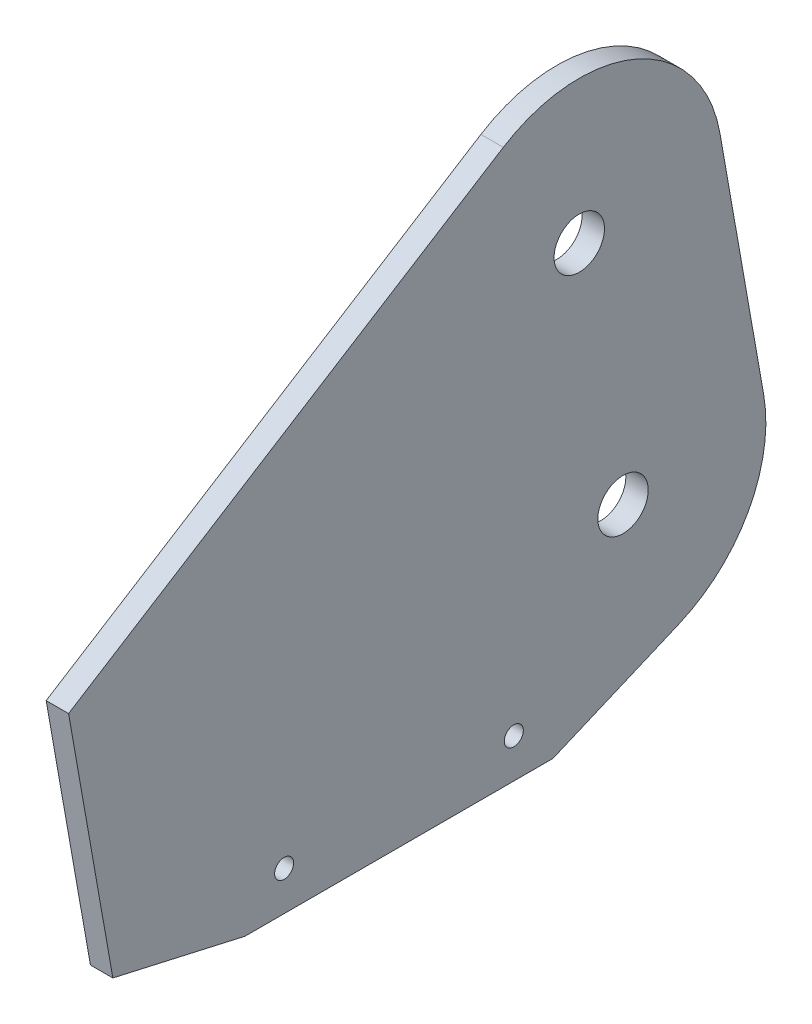
from build123d import *

# Parameters (mm, degrees)
BOSS_EXTRUDE1_DEPTH            = 4
HOLE1_D                        = 9
M3_CLEARANCE_HOLE1_D           = 3.4
M3_CLEARANCE_HOLE1_CSINK_D     = 3.45
M3_CLEARANCE_HOLE1_CSINK_ANGLE = 90


with BuildPart() as part:
    # Sketch2 → Boss-Extrude1 (new body)
    with BuildSketch(Plane.ZY.offset(18)):
        with BuildLine():
            Line((27.5, 37), (51.076666655, 42.342361278))
            Line((51.076666655, 42.342361278), (58.982401164, 87.17800967))
            Line((58.982401164, 87.17800967), (-18.625078501, 135.911625323))
            ThreePointArc((-18.625078501, 135.911625323), (-42.53183975, 137.623217481), (-57.298429707, 118.744377416))
            Line((-57.298429707, 118.744377416), (-65.112597702, 74.428028531))
            ThreePointArc((-65.112597702, 74.428028531), (-62.407971082, 57.829016803), (-49.95644752, 46.524072909))
            Line((-49.95644752, 46.524072909), (-27.5, 37))
            Line((-27.5, 37), (27.5, 37))
        make_face()
    extrude(amount=BOSS_EXTRUDE1_DEPTH)

    # Hole1 (through all)
    with Locations(Plane(origin=(-18, 0, 0), x_dir=(0, 0, -1), z_dir=(1, 0, 0))):
        with Locations((32.185832005, 114.316348886), (40, 70)):
            Hole(HOLE1_D / 2)

    # M3 Clearance Hole1 (through all)
    with Locations(Plane.ZY.offset(22)):
        with Locations((20.5, 44), (-20.5, 44)):
            CounterSinkHole(M3_CLEARANCE_HOLE1_D / 2, M3_CLEARANCE_HOLE1_CSINK_D / 2, counter_sink_angle=M3_CLEARANCE_HOLE1_CSINK_ANGLE)


solid = part.part
